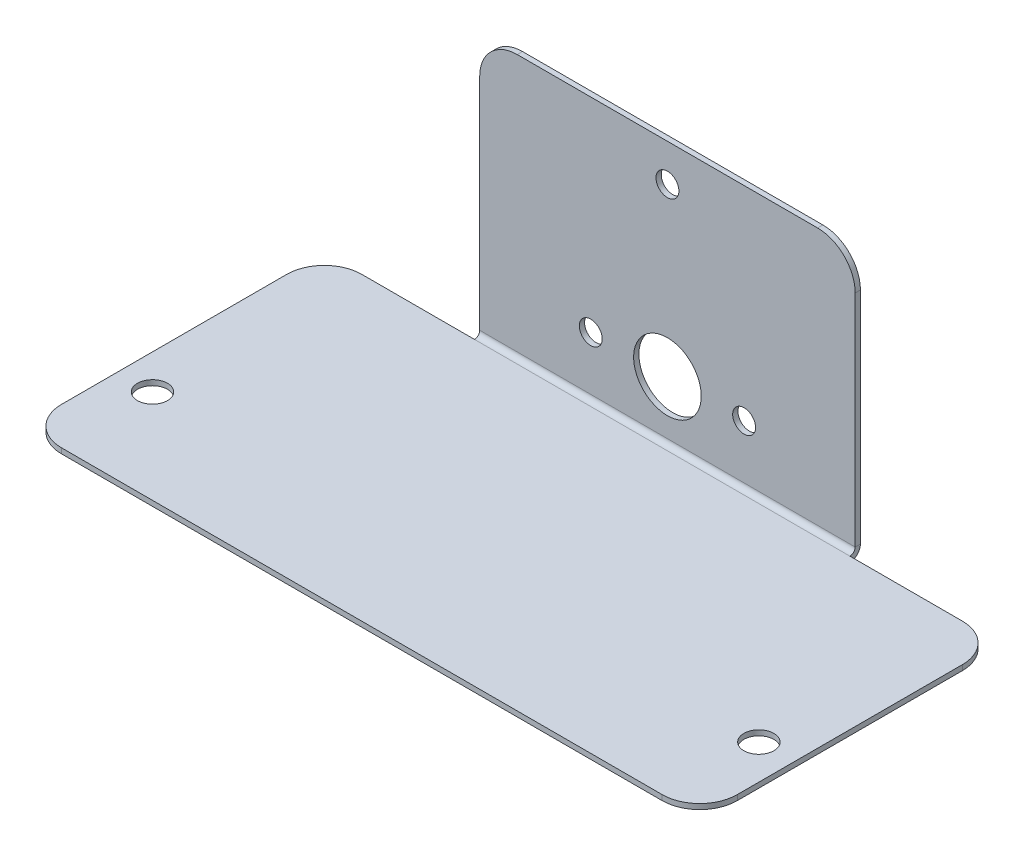
from build123d import *

# Parameters (mm, degrees)
SKETCH1_W             = 90
SKETCH1_H             = 40
BASE_FLANGE1_DEPTH    = 0.7
EDGE_FLANGE1_DEPTH    = 50
CUT_EXTRUDE1_REACH    = 72.046
SKETCH7_R             = 1.525
CUT_EXTRUDE2_REACH    = 72.046
SKETCH8_R             = 4.5
CUT_EXTRUDE4_REACH    = 62.893
SKETCH10_R            = 2
BREAK_CORNER6_START   = -21.4
BREAK_CORNER6_DEPTH   = 0.7
BREAK_CORNER6_START_2 = -0.7
BREAK_CORNER6_2_DEPTH = 0.7


# Read off the part's stored shape, not the designer's step: Break-Corner6
# Sheet-metal steps are written as plain solids
with BuildPart() as part:
    # Sketch1 → Base-Flange1 (new body)
    with BuildSketch(Plane(origin=(0, 0, 0), x_dir=(1, 0, 0), z_dir=(0, 1, 0))):
        Rectangle(SKETCH1_W, SKETCH1_H)
    extrude(amount=-BASE_FLANGE1_DEPTH)

    # Edge-Flange1 section (across the edge) → Edge-Flange1 (add)
    with BuildSketch(Plane(origin=(25, 0, -20.7), x_dir=(0, 0, 1), z_dir=(-1, 0, 0))):
        with BuildLine():
            Line((-0.7, 0.7), (-0.7, 35))
            Line((-0.7, 35), (0, 35))
            Line((0, 35), (0, 0.7))
            ThreePointArc((0, 0.7), (0.205025253, 0.205025253), (0.7, 0))
            Line((0.7, 0), (0.7, -0.7))
            ThreePointArc((0.7, -0.7), (-0.289949494, -0.289949494), (-0.7, 0.7))
        make_face()
    extrude(amount=EDGE_FLANGE1_DEPTH)

    # Sketch7 → Cut-Extrude1 (cut, up to next)
    with BuildSketch(Plane.XY.offset(-20.7), mode=Mode.PRIVATE) as cut_extrude1_sk1:
        with Locations((0, 30.02483)):
            Circle(SKETCH7_R)
    cut_extrude1_tool1 = extrude(cut_extrude1_sk1.sketch, amount=-CUT_EXTRUDE1_REACH, mode=Mode.PRIVATE) & part.part
    # Sketch7 → Cut-Extrude1 (cut, up to next)
    with BuildSketch(Plane.XY.offset(-20.7), mode=Mode.PRIVATE) as cut_extrude1_sk2:
        with Locations((10.2108, 7.85063)):
            Circle(SKETCH7_R)
    cut_extrude1_tool2 = extrude(cut_extrude1_sk2.sketch, amount=-CUT_EXTRUDE1_REACH, mode=Mode.PRIVATE) & part.part
    # Sketch7 → Cut-Extrude1 (cut, up to next)
    with BuildSketch(Plane.XY.offset(-20.7), mode=Mode.PRIVATE) as cut_extrude1_sk3:
        with Locations((-10.2108, 7.85063)):
            Circle(SKETCH7_R)
    cut_extrude1_tool3 = extrude(cut_extrude1_sk3.sketch, amount=-CUT_EXTRUDE1_REACH, mode=Mode.PRIVATE) & part.part
    add(cut_extrude1_tool1.solids().sort_by_distance((0, 30.02483, -20.7))[0], mode=Mode.SUBTRACT)
    add(cut_extrude1_tool2.solids().sort_by_distance((10.2108, 7.85063, -20.7))[0], mode=Mode.SUBTRACT)
    add(cut_extrude1_tool3.solids().sort_by_distance((-10.2108, 7.85063, -20.7))[0], mode=Mode.SUBTRACT)

    # Sketch8 → Cut-Extrude2 (cut, up to next)
    with BuildSketch(Plane.XY.offset(-20.7), mode=Mode.PRIVATE) as cut_extrude2_sk1:
        with Locations((0, 7.85063)):
            Circle(SKETCH8_R)
    cut_extrude2_tool1 = extrude(cut_extrude2_sk1.sketch, amount=-CUT_EXTRUDE2_REACH, mode=Mode.PRIVATE) & part.part
    add(cut_extrude2_tool1.solids().sort_by_distance((0, 7.85063, -20.7))[0], mode=Mode.SUBTRACT)

    # Sketch10 → Cut-Extrude4 (cut, up to next)
    with BuildSketch(Plane(origin=(0, 0, 0), x_dir=(1, 0, 0), z_dir=(0, 1, 0)), mode=Mode.PRIVATE) as cut_extrude4_sk1:
        with Locations(Location((-40.378, -7.5, 0), (0, 0, 270))):
            Circle(SKETCH10_R)
    cut_extrude4_tool1 = extrude(cut_extrude4_sk1.sketch, amount=-CUT_EXTRUDE4_REACH, mode=Mode.PRIVATE) & part.part
    # Sketch10 → Cut-Extrude4 (cut, up to next)
    with BuildSketch(Plane(origin=(0, 0, 0), x_dir=(1, 0, 0), z_dir=(0, 1, 0)), mode=Mode.PRIVATE) as cut_extrude4_sk2:
        with Locations(Location((40.378, -7.5, 0), (0, 0, 270))):
            Circle(SKETCH10_R)
    cut_extrude4_tool2 = extrude(cut_extrude4_sk2.sketch, amount=-CUT_EXTRUDE4_REACH, mode=Mode.PRIVATE) & part.part
    add(cut_extrude4_tool1.solids().sort_by_distance((-40.378, 0, 7.5))[0], mode=Mode.SUBTRACT)
    add(cut_extrude4_tool2.solids().sort_by_distance((40.378, 0, 7.5))[0], mode=Mode.SUBTRACT)

    # Break-Corner6 outline → Break-Corner6 (cut)
    with BuildSketch(Plane.XY.offset(BREAK_CORNER6_START)):
        with BuildLine():
            ThreePointArc((-25, 30), (-23.535533906, 33.535533906), (-20, 35))
            Line((-20, 35), (-25, 35))
            Line((-25, 35), (-25, 30))
        make_face()
        with BuildLine():
            ThreePointArc((20, 35), (23.535533906, 33.535533906), (25, 30))
            Line((25, 30), (25, 35))
            Line((25, 35), (20, 35))
        make_face()
    extrude(amount=BREAK_CORNER6_DEPTH, mode=Mode.SUBTRACT)

    # Break-Corner6 2 outline → Break-Corner6 2 (cut)
    with BuildSketch(Plane(origin=(0, 0, 0), x_dir=(1, 0, 0), z_dir=(0, 1, 0)).offset(BREAK_CORNER6_START_2)):
        with BuildLine():
            ThreePointArc((40, 20), (43.535533906, 18.535533906), (45, 15))
            Line((45, 15), (45, 20))
            Line((45, 20), (40, 20))
        make_face()
        with BuildLine():
            Line((-45, 20), (-45, 15))
            ThreePointArc((-45, 15), (-43.535533906, 18.535533906), (-40, 20))
            Line((-40, 20), (-45, 20))
        make_face()
        with BuildLine():
            Line((-45, -20), (-40, -20))
            ThreePointArc((-40, -20), (-43.535533906, -18.535533906), (-45, -15))
            Line((-45, -15), (-45, -20))
        make_face()
        with BuildLine():
            ThreePointArc((45, -15), (43.535533906, -18.535533906), (40, -20))
            Line((40, -20), (45, -20))
            Line((45, -20), (45, -15))
        make_face()
    extrude(amount=BREAK_CORNER6_2_DEPTH, mode=Mode.SUBTRACT)


solid = part.part
